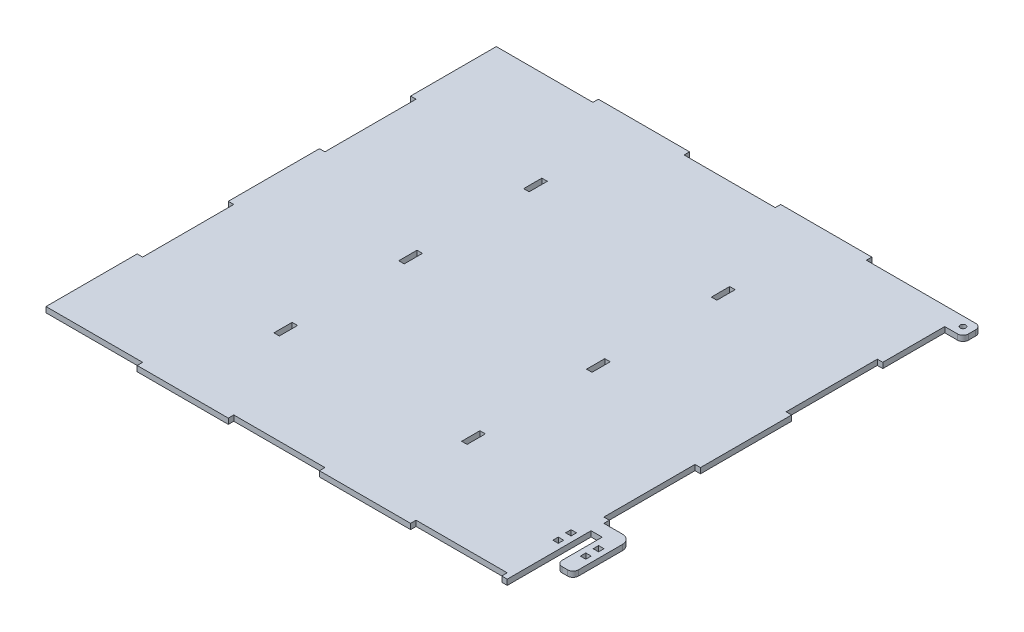
from build123d import *

# Parameters (mm, degrees)
SKETCH1_R           = 1.5
SKETCH1_W           = 3
SKETCH1_H           = 3
SKETCH1_H_2         = 10
BOSS_EXTRUDE1_DEPTH = 3


with BuildPart() as part:
    # Sketch1 → Boss-Extrude1 (new body)
    with BuildSketch(Plane(origin=(0, 0, 0), x_dir=(1, 0, 0), z_dir=(0, 1, 0))):
        with BuildLine():
            Line((256, 103), (256, 153))
            Line((256, 153), (253, 153))
            Line((253, 153), (253, 203))
            Line((253, 203), (256, 203))
            Line((256, 203), (256, 237))
            Line((256, 237), (263, 237))
            ThreePointArc((263, 237), (265.121320344, 237.878679656), (266, 240))
            Line((266, 240), (266, 244))
            ThreePointArc((266, 244), (265.121320344, 246.121320344), (263, 247))
            Line((263, 247), (253, 247))
            Line((253, 247), (203, 247))
            Line((203, 247), (203, 250))
            Line((203, 250), (153, 250))
            Line((153, 250), (153, 247))
            Line((153, 247), (103, 247))
            Line((103, 247), (103, 250))
            Line((103, 250), (53, 250))
            Line((53, 250), (53, 247))
            Line((53, 247), (0, 247))
            Line((0, 247), (0, 200))
            Line((0, 200), (3, 200))
            Line((3, 200), (3, 150))
            Line((3, 150), (0, 150))
            Line((0, 150), (0, 100))
            Line((0, 100), (3, 100))
            Line((3, 100), (3, 50))
            Line((3, 50), (0, 50))
            Line((0, 50), (0, 0))
            Line((0, 0), (53, 0))
            Line((53, 0), (53, -3))
            Line((53, -3), (103, -3))
            Line((103, -3), (103, 0))
            Line((103, 0), (153, 0))
            Line((153, 0), (153, -3))
            Line((153, -3), (203, -3))
            Line((203, -3), (203, 0))
            Line((203, 0), (253, 0))
            Line((253, 0), (253, -3))
            Line((253, -3), (256, -3))
            Line((256, -3), (256, 0))
            Line((256, 0), (256, 43))
            Line((256, 43), (262.1, 43))
            Line((262.1, 43), (262.1, 21))
            ThreePointArc((262.1, 21), (262.978679656, 18.878679656), (265.1, 18))
            Line((265.1, 18), (268.1, 18))
            ThreePointArc((268.1, 18), (270.221320344, 18.878679656), (271.1, 21))
            Line((271.1, 21), (271.1, 43))
            Line((271.1, 43), (271.1, 45))
            ThreePointArc((271.1, 45), (269.635533906, 48.535533906), (266.1, 50))
            Line((266.1, 50), (256, 50))
            Line((256, 50), (256, 53))
            Line((256, 53), (253, 53))
            Line((253, 53), (253, 103))
            Line((253, 103), (256, 103))
        make_face()
        with Locations((261, 242)):
            Circle(SKETCH1_R, mode=Mode.SUBTRACT)
        with Locations((266.6, 29.5)):
            Rectangle(SKETCH1_W, SKETCH1_H, mode=Mode.SUBTRACT)
        with Locations((266.6, 36.5)):
            Rectangle(SKETCH1_W, SKETCH1_H, mode=Mode.SUBTRACT)
        with Locations((251.5, 29.5)):
            Rectangle(SKETCH1_W, SKETCH1_H, mode=Mode.SUBTRACT)
        with Locations((251.5, 36.5)):
            Rectangle(SKETCH1_W, SKETCH1_H, mode=Mode.SUBTRACT)
        with Locations((76.5, 55)):
            Rectangle(SKETCH1_W, SKETCH1_H_2, mode=Mode.SUBTRACT)
        with Locations((179.5, 55)):
            Rectangle(SKETCH1_W, SKETCH1_H_2, mode=Mode.SUBTRACT)
        with Locations((76.5, 123.5)):
            Rectangle(SKETCH1_W, SKETCH1_H_2, mode=Mode.SUBTRACT)
        with Locations((179.5, 123.5)):
            Rectangle(SKETCH1_W, SKETCH1_H_2, mode=Mode.SUBTRACT)
        with Locations((76.5, 192)):
            Rectangle(SKETCH1_W, SKETCH1_H_2, mode=Mode.SUBTRACT)
        with Locations((179.5, 192)):
            Rectangle(SKETCH1_W, SKETCH1_H_2, mode=Mode.SUBTRACT)
    extrude(amount=BOSS_EXTRUDE1_DEPTH)


solid = part.part
